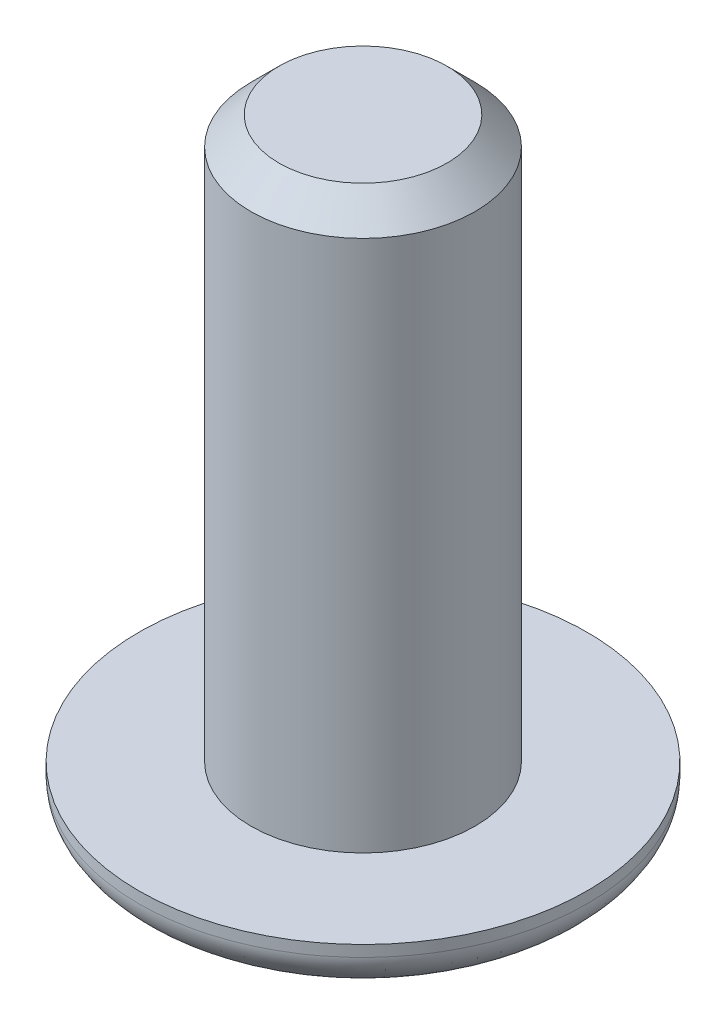
from build123d import *

# Parameters (mm, degrees)
SKETCH_1_R      = 4
EXTRUDE_1_DEPTH = 1.2
SKETCH_2_R      = 2
EXTRUDE_2_DEPTH = 10
CHAMFER_1_SIZE  = 0.5
FILLET_1_SIZE   = 1
FILLET_1_SIZE_2 = 2


with BuildPart() as part:
    # 草图1 → 凸台-拉伸1 (new body)
    with BuildSketch(Plane(origin=(0, 0, 0), x_dir=(1, 0, 0), z_dir=(0, 1, 0))):
        with Locations(Location((0, 0, 0), (0, 0, 270))):
            Circle(SKETCH_1_R)
        Polygon((1.443375673, 0), (0.721687836, 1.25), (-0.721687836, 1.25), (-1.443375673, 0), (-0.721687836, -1.25), (0.721687836, -1.25), align=None, mode=Mode.SUBTRACT)
    extrude(amount=EXTRUDE_1_DEPTH)

    # 草图2 → 凸台-拉伸2 (add)
    with BuildSketch(Plane(origin=(0, 1.2, 0), x_dir=(1, 0, 0), z_dir=(0, 1, 0))):
        with Locations(Location((0, 0, 0), (0, 0, 270))):
            Circle(SKETCH_2_R)
    extrude(amount=EXTRUDE_2_DEPTH)

    # 倒角1
    chamfer_1_edges = [part.edges().sort_by_distance(p)[0] for p in [
        (0, 11.2, -2),
    ]]
    chamfer(chamfer_1_edges, length=CHAMFER_1_SIZE)

    # 圆角1
    # an asymmetric fillet: 2, 1 mm, written as the material it takes off along each edge
    with BuildSketch(Plane(origin=(0, 0, 0), x_dir=(0, 0, 1), z_dir=(-1, 0, 0))) as fillet_1_piece_1:
        with BuildLine():
            Bezier((4, FILLET_1_SIZE), (4, 0), (4 - FILLET_1_SIZE_2, 0), weights=[1, 0.707106781, 1])
            Line((4 - FILLET_1_SIZE_2, 0), (4, 0))
            Line((4, 0), (4, FILLET_1_SIZE))
        make_face()
    revolve(axis=Axis((0, 0, 0), (0, 1, 0)), mode=Mode.SUBTRACT)


solid = part.part
